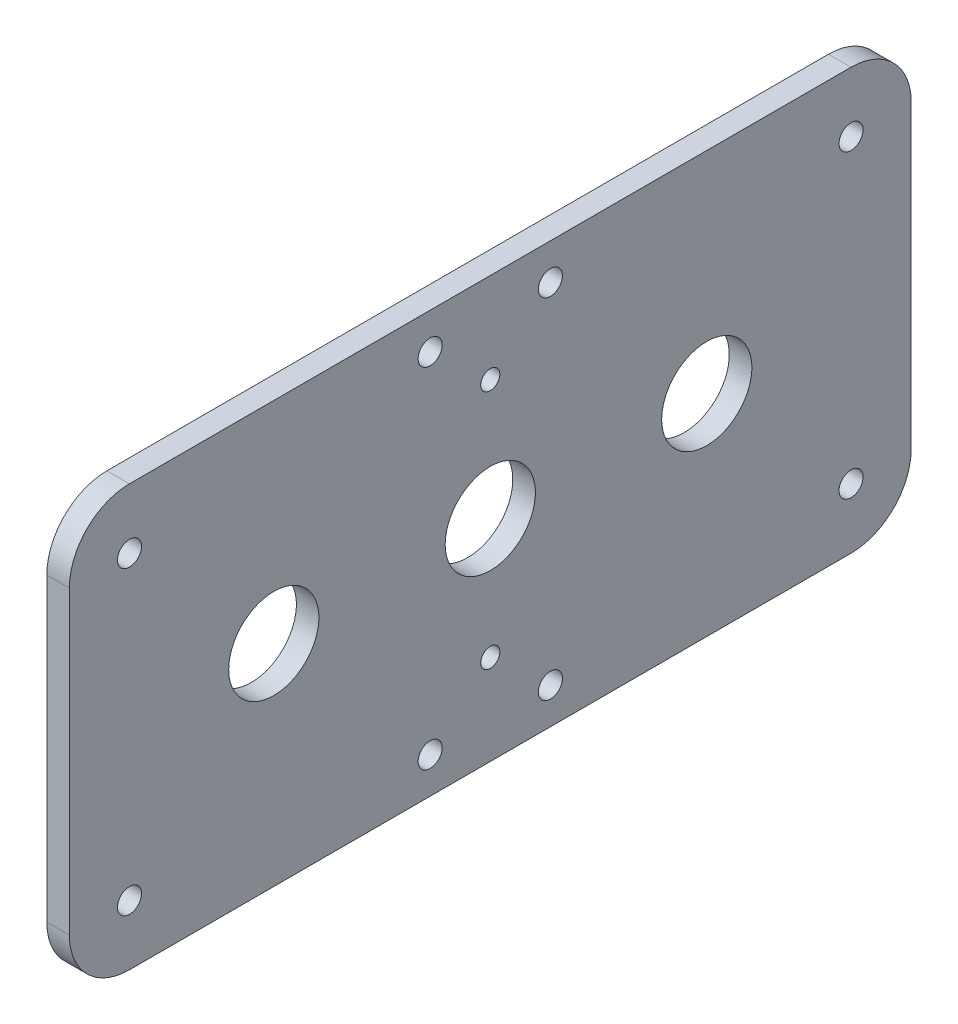
from build123d import *

# Parameters (mm, degrees)
SKETCH1_R           = 2.54
SKETCH1_R_2         = 2.0193
SKETCH1_R_3         = 9.525
BOSS_EXTRUDE1_DEPTH = 4.7625


with BuildPart() as part:
    # Sketch1 → Boss-Extrude1 (new body)
    with BuildSketch(Plane(origin=(0, 0, 0), x_dir=(0, 0, -1), z_dir=(1, 0, 0))):
        with BuildLine():
            Line((226.734866781, 43.274288567), (226.734866781, 106.774288567))
            ThreePointArc((226.734866781, 106.774288567), (230.45461066, 115.754544688), (239.434866781, 119.474288567))
            Line((239.434866781, 119.474288567), (391.834866781, 119.474288567))
            ThreePointArc((391.834866781, 119.474288567), (400.815122902, 115.754544688), (404.534866781, 106.774288567))
            Line((404.534866781, 106.774288567), (404.534866781, 43.274288567))
            ThreePointArc((404.534866781, 43.274288567), (400.815122902, 34.294032445), (391.834866781, 30.574288567))
            Line((391.834866781, 30.574288567), (239.434866781, 30.574288567))
            ThreePointArc((239.434866781, 30.574288567), (230.45461066, 34.294032445), (226.734866781, 43.274288567))
        make_face()
        with Locations(Location((302.934866781, 111.854288567, 0), (0, 0, 180))):
            Circle(SKETCH1_R, mode=Mode.SUBTRACT)
        with Locations(Location((328.334866781, 111.854288567, 0), (0, 0, 180))):
            Circle(SKETCH1_R, mode=Mode.SUBTRACT)
        with Locations(Location((315.634866781, 100.424288567, 0), (0, 0, 180))):
            Circle(SKETCH1_R_2, mode=Mode.SUBTRACT)
        with Locations(Location((302.934866781, 38.194288567, 0), (0, 0, 180))):
            Circle(SKETCH1_R, mode=Mode.SUBTRACT)
        with Locations(Location((328.334866781, 38.194288567, 0), (0, 0, 180))):
            Circle(SKETCH1_R, mode=Mode.SUBTRACT)
        with Locations(Location((239.434866781, 43.274288567, 0), (0, 0, 180))):
            Circle(SKETCH1_R, mode=Mode.SUBTRACT)
        with Locations(Location((391.834866781, 43.274288567, 0), (0, 0, 180))):
            Circle(SKETCH1_R, mode=Mode.SUBTRACT)
        with Locations(Location((315.634866781, 75.024288567, 0), (0, 0, 180))):
            Circle(SKETCH1_R_3, mode=Mode.SUBTRACT)
        with Locations(Location((315.634866781, 49.624288567, 0), (0, 0, 180))):
            Circle(SKETCH1_R_2, mode=Mode.SUBTRACT)
        with Locations(Location((239.434866781, 106.774288567, 0), (0, 0, 180))):
            Circle(SKETCH1_R, mode=Mode.SUBTRACT)
        with Locations(Location((391.834866781, 106.774288567, 0), (0, 0, 180))):
            Circle(SKETCH1_R, mode=Mode.SUBTRACT)
        with Locations(Location((269.914866781, 75.024288567, 0), (0, 0, 180))):
            Circle(SKETCH1_R_3, mode=Mode.SUBTRACT)
        with Locations(Location((361.354866781, 75.024288567, 0), (0, 0, 180))):
            Circle(SKETCH1_R_3, mode=Mode.SUBTRACT)
    extrude(amount=BOSS_EXTRUDE1_DEPTH)


with BuildPart() as part_1:
    # Body-Move/Copy1: moved
    add(part.part.moved(Location((0, 0, 631.269733563))))


solid = part_1.part
